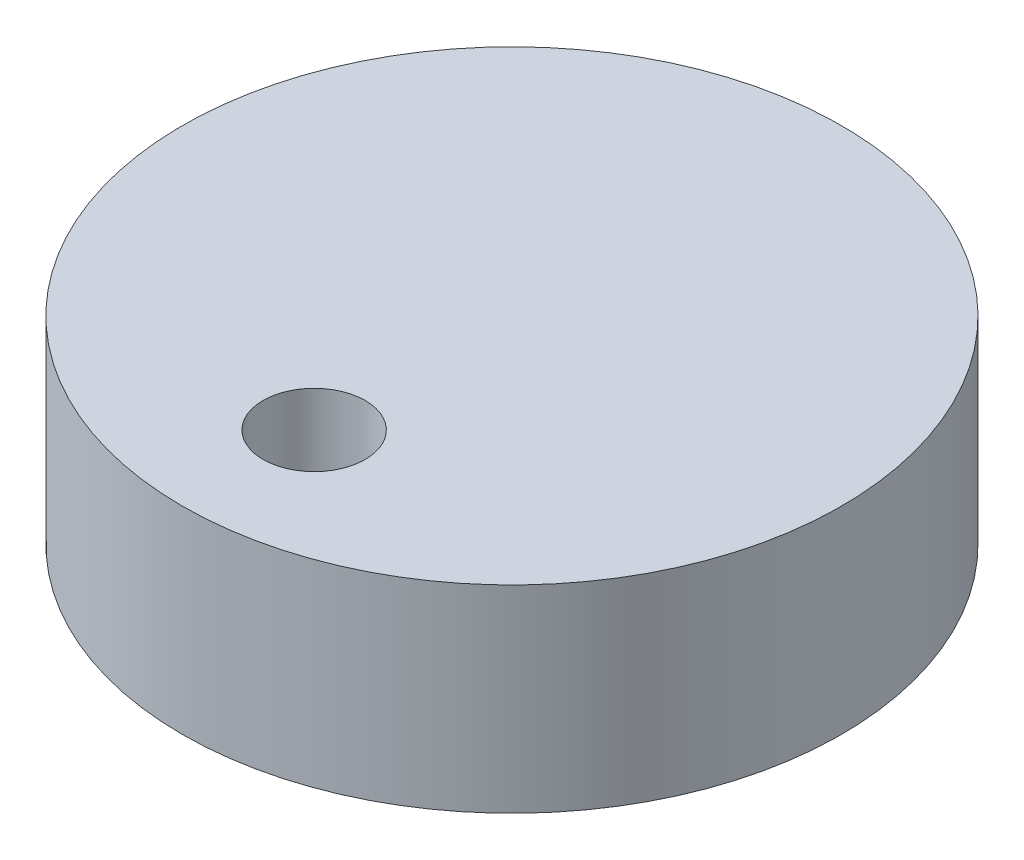
from build123d import *

# Parameters (mm, degrees)
SKETCH1_R           = 10
BOSS_EXTRUDE1_DEPTH = 6
HOLE1_OUTLINE_R     = 1.55
HOLE1_DEPTH         = 6


# Read off the part's stored shape, not the designer's step: Hole1
with BuildPart() as part:
    # Sketch1 → Boss-Extrude1 (new body)
    with BuildSketch(Plane(origin=(0, 0, 0), x_dir=(1, 0, 0), z_dir=(0, 1, 0))):
        with Locations(Location((0, 0, 0), (0, 0, 270))):
            Circle(SKETCH1_R)
    extrude(amount=BOSS_EXTRUDE1_DEPTH)

    # Hole1 outline → Hole1 (cut)
    with BuildSketch(Plane(origin=(0, 0, 0), x_dir=(1, 0, 0), z_dir=(0, 1, 0))):
        with Locations((-0.002353502, -5.99935518)):
            Circle(HOLE1_OUTLINE_R)
    extrude(amount=HOLE1_DEPTH, mode=Mode.SUBTRACT)


solid = part.part
